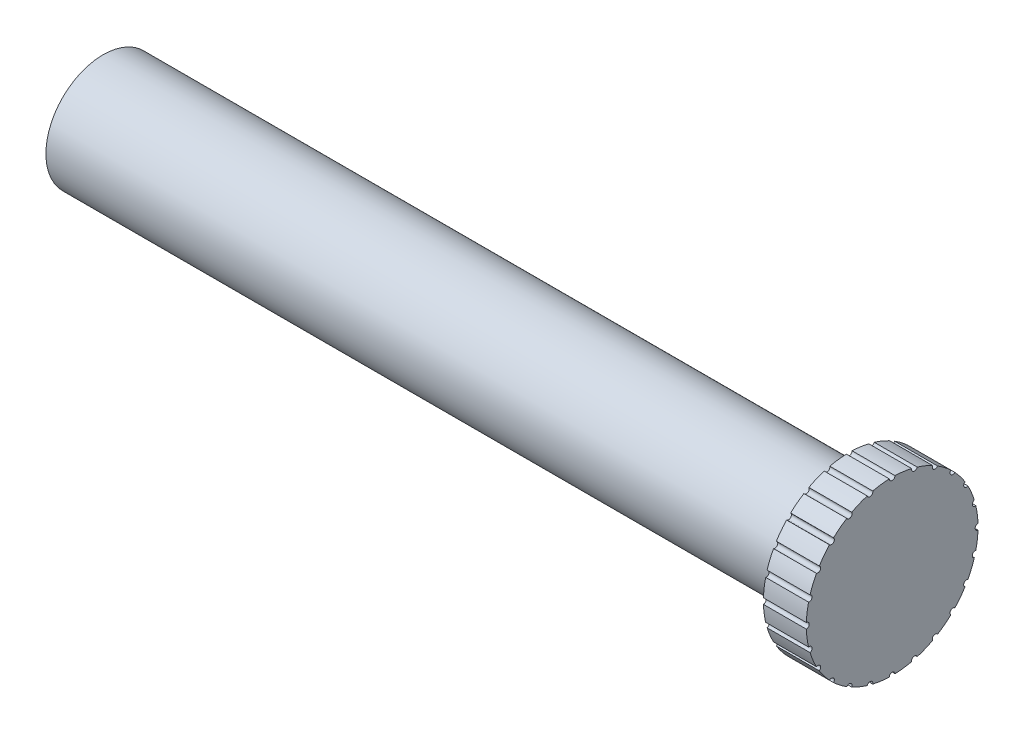
from build123d import *

# Parameters (mm, degrees)
SKETCH1_R           = 4
BOSS_EXTRUDE1_DEPTH = 52.14
SKETCH2_R           = 6
BOSS_EXTRUDE2_DEPTH = 3
SKETCH3_R           = 0.2
CUT_EXTRUDE1_DEPTH  = 3
CIRPATTERN1_START   = 52.14
CIRPATTERN1_DEPTH   = 3


# Read off the part's stored shape, not the designer's step: CirPattern1
with BuildPart() as part:
    # Sketch1 → Boss-Extrude1 (new body)
    with BuildSketch(Plane(origin=(0, 0, 0), x_dir=(0, 0, -1), z_dir=(1, 0, 0))):
        Circle(SKETCH1_R)
    extrude(amount=BOSS_EXTRUDE1_DEPTH)

    # Sketch2 → Boss-Extrude2 (add)
    with BuildSketch(Plane(origin=(52.14, 0, 0), x_dir=(0, 0, -1), z_dir=(1, 0, 0))):
        Circle(SKETCH2_R)
    extrude(amount=BOSS_EXTRUDE2_DEPTH)

    # Sketch3 → Cut-Extrude1 (cut)
    with BuildSketch(Plane(origin=(55.14, 0, 0), x_dir=(0, 0, -1), z_dir=(1, 0, 0))):
        with Locations((-6, 0)):
            Circle(SKETCH3_R)
    extrude(amount=-CUT_EXTRUDE1_DEPTH, mode=Mode.SUBTRACT)

    # CirPattern1 outline → CirPattern1 (cut)
    with BuildSketch(Plane.YZ.offset(CIRPATTERN1_START)):
        with BuildLine():
            ThreePointArc((-1.358893208, 5.844091824), (-1.552914271, 5.795554958), (-1.745209873, 5.740578586))
            ThreePointArc((-1.745209873, 5.740578586), (-1.501150462, 5.602369792), (-1.358893208, 5.844091824))
        make_face()
        with BuildLine():
            ThreePointArc((1.358893208, 5.844091824), (1.501150462, 5.602369792), (1.745209873, 5.740578586))
            ThreePointArc((1.745209873, 5.740578586), (1.552914271, 5.795554958), (1.358893208, 5.844091824))
        make_face()
        with BuildLine():
            ThreePointArc((2.825152311, 5.293251782), (2.9, 5.022947342), (3.171514356, 5.093279561))
            ThreePointArc((3.171514356, 5.093279561), (3, 5.196152423), (2.825152311, 5.293251782))
        make_face()
        with BuildLine():
            ThreePointArc((4.098881951, 4.381685378), (4.101219331, 4.101219331), (4.381685378, 4.098881951))
            ThreePointArc((4.381685378, 4.098881951), (4.242640687, 4.242640687), (4.098881951, 4.381685378))
        make_face()
        with BuildLine():
            ThreePointArc((5.093279561, 3.171514356), (5.022947342, 2.9), (5.293251782, 2.825152311))
            ThreePointArc((5.293251782, 2.825152311), (5.196152423, 3), (5.093279561, 3.171514356))
        make_face()
        with BuildLine():
            ThreePointArc((5.740578586, 1.745209873), (5.602369792, 1.501150462), (5.844091824, 1.358893208))
            ThreePointArc((5.844091824, 1.358893208), (5.795554958, 1.552914271), (5.740578586, 1.745209873))
        make_face()
        with BuildLine():
            ThreePointArc((5.996666667, 0.19997222), (5.8, 0), (5.996666667, -0.19997222))
            ThreePointArc((5.996666667, -0.19997222), (6, 0), (5.996666667, 0.19997222))
        make_face()
        with BuildLine():
            ThreePointArc((5.844091824, -1.358893208), (5.602369792, -1.501150462), (5.740578586, -1.745209873))
            ThreePointArc((5.740578586, -1.745209873), (5.795554958, -1.552914271), (5.844091824, -1.358893208))
        make_face()
        with BuildLine():
            ThreePointArc((5.293251782, -2.825152311), (5.022947342, -2.9), (5.093279561, -3.171514356))
            ThreePointArc((5.093279561, -3.171514356), (5.196152423, -3), (5.293251782, -2.825152311))
        make_face()
        with BuildLine():
            ThreePointArc((4.381685378, -4.098881951), (4.101219331, -4.101219331), (4.098881951, -4.381685378))
            ThreePointArc((4.098881951, -4.381685378), (4.242640687, -4.242640687), (4.381685378, -4.098881951))
        make_face()
        with BuildLine():
            ThreePointArc((3.171514356, -5.093279561), (2.9, -5.022947342), (2.825152311, -5.293251782))
            ThreePointArc((2.825152311, -5.293251782), (3, -5.196152423), (3.171514356, -5.093279561))
        make_face()
        with BuildLine():
            ThreePointArc((1.745209873, -5.740578586), (1.501150462, -5.602369792), (1.358893208, -5.844091824))
            ThreePointArc((1.358893208, -5.844091824), (1.552914271, -5.795554958), (1.745209873, -5.740578586))
        make_face()
        with BuildLine():
            ThreePointArc((0.19997222, -5.996666667), (0, -5.8), (-0.19997222, -5.996666667))
            ThreePointArc((-0.19997222, -5.996666667), (0, -6), (0.19997222, -5.996666667))
        make_face()
        with BuildLine():
            ThreePointArc((-1.358893208, -5.844091824), (-1.501150462, -5.602369792), (-1.745209873, -5.740578586))
            ThreePointArc((-1.745209873, -5.740578586), (-1.552914271, -5.795554958), (-1.358893208, -5.844091824))
        make_face()
        with BuildLine():
            ThreePointArc((-2.825152311, -5.293251782), (-2.9, -5.022947342), (-3.171514356, -5.093279561))
            ThreePointArc((-3.171514356, -5.093279561), (-3, -5.196152423), (-2.825152311, -5.293251782))
        make_face()
        with BuildLine():
            ThreePointArc((-4.098881951, -4.381685378), (-4.101219331, -4.101219331), (-4.381685378, -4.098881951))
            ThreePointArc((-4.381685378, -4.098881951), (-4.242640687, -4.242640687), (-4.098881951, -4.381685378))
        make_face()
        with BuildLine():
            ThreePointArc((-5.093279561, -3.171514356), (-5.022947342, -2.9), (-5.293251782, -2.825152311))
            ThreePointArc((-5.293251782, -2.825152311), (-5.196152423, -3), (-5.093279561, -3.171514356))
        make_face()
        with BuildLine():
            ThreePointArc((-5.740578586, -1.745209873), (-5.602369792, -1.501150462), (-5.844091824, -1.358893208))
            ThreePointArc((-5.844091824, -1.358893208), (-5.795554958, -1.552914271), (-5.740578586, -1.745209873))
        make_face()
        with BuildLine():
            ThreePointArc((-5.996666667, -0.19997222), (-5.8, 0), (-5.996666667, 0.19997222))
            ThreePointArc((-5.996666667, 0.19997222), (-6, 0), (-5.996666667, -0.19997222))
        make_face()
        with BuildLine():
            ThreePointArc((-5.844091824, 1.358893208), (-5.602369792, 1.501150462), (-5.740578586, 1.745209873))
            ThreePointArc((-5.740578586, 1.745209873), (-5.795554958, 1.552914271), (-5.844091824, 1.358893208))
        make_face()
        with BuildLine():
            ThreePointArc((-5.293251782, 2.825152311), (-5.022947342, 2.9), (-5.093279561, 3.171514356))
            ThreePointArc((-5.093279561, 3.171514356), (-5.196152423, 3), (-5.293251782, 2.825152311))
        make_face()
        with BuildLine():
            ThreePointArc((-4.381685378, 4.098881951), (-4.101219331, 4.101219331), (-4.098881951, 4.381685378))
            ThreePointArc((-4.098881951, 4.381685378), (-4.242640687, 4.242640687), (-4.381685378, 4.098881951))
        make_face()
        with BuildLine():
            ThreePointArc((-3.171514356, 5.093279561), (-2.9, 5.022947342), (-2.825152311, 5.293251782))
            ThreePointArc((-2.825152311, 5.293251782), (-3, 5.196152423), (-3.171514356, 5.093279561))
        make_face()
    extrude(amount=CIRPATTERN1_DEPTH, mode=Mode.SUBTRACT)


solid = part.part
